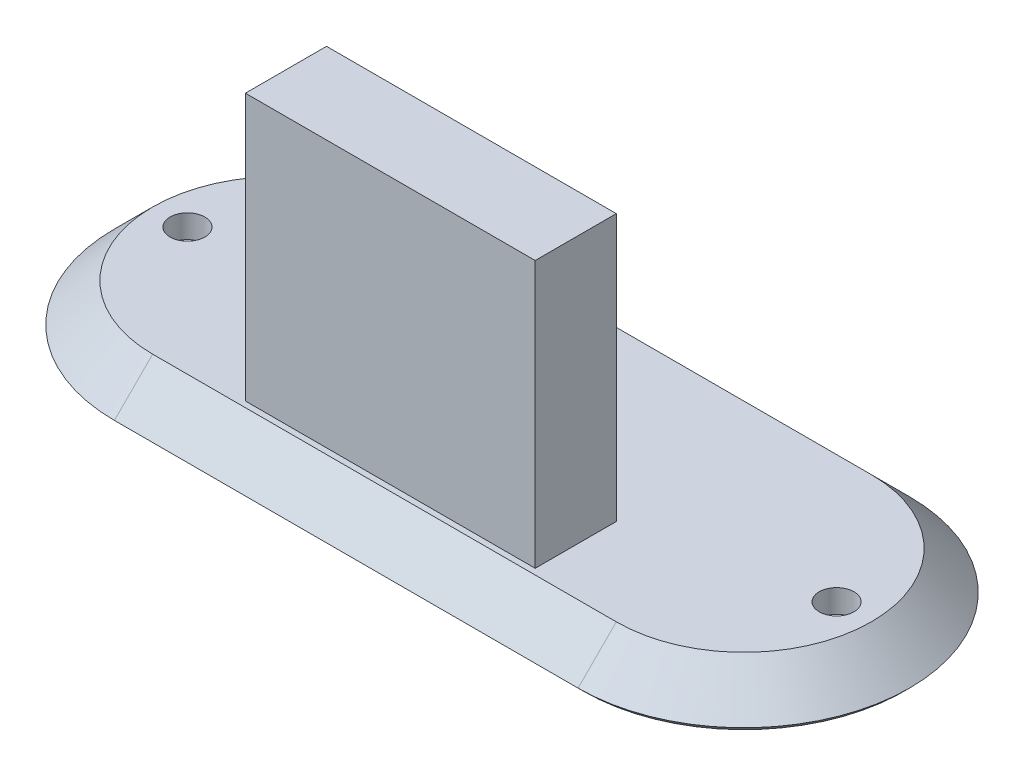
from build123d import *
from OCP.BRepFilletAPI import BRepFilletAPI_MakeChamfer

# Parameters (mm, degrees)
BOSS_EXTRU_1_DEPTH      = 3.8
BOSS_EXTRU_1_TAPER      = 45
COQUE2_DEPTH            = 1.8
COQUE2_DRAFT            = 45
CHANFREIN1_SIZE         = 1
CHANFREIN1_SIZE2        = 0.707106781
ENL_V_MAT_EXTRU_1_REACH = 39.355
ESQUISSE2_R             = 1.5
BOSS_EXTRU_2_DEPTH      = 21
ESQUISSE5_W             = 25
ESQUISSE5_H             = 7
BOSS_EXTRU_3_DEPTH      = 2
ESQUISSE6_W             = 16
ESQUISSE6_H             = 2
ENL_V_MAT_EXTRU_2_DEPTH = 2


# Read off the part's stored shape, not the designer's step: Coque2
with BuildPart() as part:
    # Esquisse1 → Boss.-Extru.1 (new body)
    with BuildSketch(Plane(origin=(0, 0, 0), x_dir=(1, 0, 0), z_dir=(0, 1, 0))):
        with BuildLine():
            ThreePointArc((-20, 14.8), (-34.8, 0), (-20, -14.8))
            Line((-20, -14.8), (20, -14.8))
            ThreePointArc((20, -14.8), (34.8, 0), (20, 14.8))
            Line((20, 14.8), (-20, 14.8))
        make_face()
    extrude(amount=BOSS_EXTRU_1_DEPTH, taper=BOSS_EXTRU_1_TAPER)


with BuildPart() as coque2_tool:
    # Coque2 outline → Coque2 (with draft: the straight prism first)
    with BuildSketch(Plane(origin=(0, 1.8, 0), x_dir=(1, 0, 0), z_dir=(0, 1, 0))):
        with BuildLine():
            Line((-20, -10.171572875), (20, -10.171572875))
            ThreePointArc((20, -10.171572875), (30.171572875, 0), (20, 10.171572875))
            Line((20, 10.171572875), (-20, 10.171572875))
            ThreePointArc((-20, 10.171572875), (-30.171572875, 0), (-20, -10.171572875))
        make_face()
    extrude(amount=-COQUE2_DEPTH)
    # Coque2: the draft: its side faces are tilted about the plane it starts from
    coque2_sides = [coque2_tool.faces().sort_by_distance(p)[0] for p in [
        (0, 0.9, 10.171572875),
        (30.171572875, 0.9, 0),
        (0, 0.9, -10.171572875),
        (-30.171572875, 0.9, 0),
    ]]
    draft(coque2_sides, Plane(origin=(0, 1.8, 0), x_dir=(1, 0, 0), z_dir=(0, 1, 0)), COQUE2_DRAFT)


with BuildPart() as part_1:
    add(part.part)

    # Coque2: cut by coque2_tool
    add(coque2_tool.part, mode=Mode.SUBTRACT)

    # Chanfrein1: one chamfer whose edges measure the first distance from different faces: ONE call of the kernel's chamfer builder (chamfer() names one face for all edges)
    chanfrein1_edges_1 = [part_1.edges().sort_by_distance(p)[0] for p in [
        (0, 0, -14.8),
        (0, 0, 14.8),
        (-34.8, 0, 0),
    ]]
    chanfrein1_side_1 = [part_1.faces().sort_by_distance(p)[0] for p in [
        (0, 0, -14.043672029),
    ]]
    chanfrein1_edges_2 = [part_1.edges().sort_by_distance(p)[0] for p in [
        (34.8, 0, 0),
    ]]
    chanfrein1_side_2 = [part_1.faces().sort_by_distance(p)[0] for p in [
        (32.9, 1.9, 0),
    ]]
    chanfrein1 = BRepFilletAPI_MakeChamfer(part_1.part.solid().wrapped)
    for e in chanfrein1_edges_1:
        chanfrein1.Add(CHANFREIN1_SIZE, CHANFREIN1_SIZE2, e.wrapped, chanfrein1_side_1[0].wrapped)  # the first distance lies on this face
    for e in chanfrein1_edges_2:
        chanfrein1.Add(CHANFREIN1_SIZE, CHANFREIN1_SIZE2, e.wrapped, chanfrein1_side_2[0].wrapped)  # the first distance lies on this face
    add(Compound.cast(chanfrein1.Shape()), mode=Mode.REPLACE)

    # Esquisse2 → Enlèv. mat.-Extru.1 (cut, up to next)
    with BuildSketch(Plane(origin=(0, 3.8, 0), x_dir=(1, 0, 0), z_dir=(0, 1, 0)), mode=Mode.PRIVATE) as enl_v_mat_extru_1_sk1:
        with Locations(Location((-28, 0, 0), (0, 0, 270))):
            Circle(ESQUISSE2_R)
    enl_v_mat_extru_1_tool1 = extrude(enl_v_mat_extru_1_sk1.sketch, amount=-ENL_V_MAT_EXTRU_1_REACH, mode=Mode.PRIVATE) & part_1.part
    # Esquisse2 → Enlèv. mat.-Extru.1 (cut, up to next)
    with BuildSketch(Plane(origin=(0, 3.8, 0), x_dir=(1, 0, 0), z_dir=(0, 1, 0)), mode=Mode.PRIVATE) as enl_v_mat_extru_1_sk2:
        with Locations(Location((28, 0, 0), (0, 0, 270))):
            Circle(ESQUISSE2_R)
    enl_v_mat_extru_1_tool2 = extrude(enl_v_mat_extru_1_sk2.sketch, amount=-ENL_V_MAT_EXTRU_1_REACH, mode=Mode.PRIVATE) & part_1.part
    add(enl_v_mat_extru_1_tool1.solids().sort_by_distance((-28, 3.8, 0))[0], mode=Mode.SUBTRACT)
    add(enl_v_mat_extru_1_tool2.solids().sort_by_distance((28, 3.8, 0))[0], mode=Mode.SUBTRACT)

    # Esquisse3 → Boss.-Extru.2 (add)
    with BuildSketch(Plane(origin=(0, 3.8, 0), x_dir=(1, 0, 0), z_dir=(0, 1, 0))):
        Polygon((-10.5, -8.5), (10.5, -8.5), (10.5, -3.5), (12.5, -3.5), (12.5, -10.5), (-12.5, -10.5), (-12.5, -3.5), (-10.5, -3.5), align=None)
    extrude(amount=BOSS_EXTRU_2_DEPTH)

    # Esquisse5 → Boss.-Extru.3 (add)
    with BuildSketch(Plane(origin=(0, 24.8, 0), x_dir=(1, 0, 0), z_dir=(0, 1, 0))):
        with Locations((0, -7)):
            Rectangle(ESQUISSE5_W, ESQUISSE5_H)
    extrude(amount=BOSS_EXTRU_3_DEPTH)

    # Esquisse6 → Enlèv. mat.-Extru.2 (cut)
    with BuildSketch(Plane(origin=(0, 3.8, 0), x_dir=(1, 0, 0), z_dir=(0, 1, 0))):
        with Locations((0, -7.5)):
            Rectangle(ESQUISSE6_W, ESQUISSE6_H)
    extrude(amount=-ENL_V_MAT_EXTRU_2_DEPTH, mode=Mode.SUBTRACT)


solid = part_1.part
